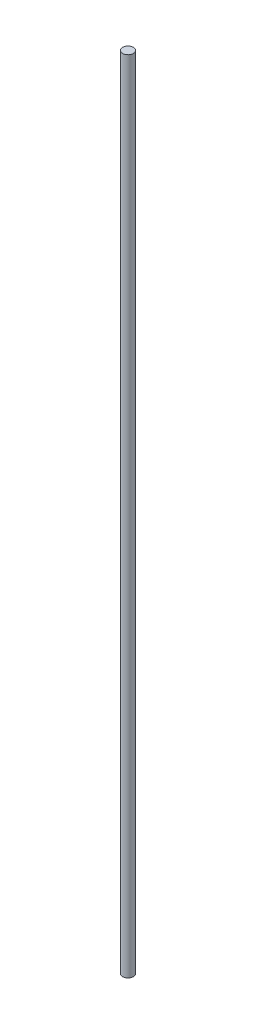
from build123d import *

# Parameters (mm, degrees)
SKETCH1_R           = 1.61925
BOSS_EXTRUDE1_DEPTH = 241.3


with BuildPart() as part:
    # Sketch1 → Boss-Extrude1 (new body)
    with BuildSketch(Plane(origin=(0, 0, 0), x_dir=(1, 0, 0), z_dir=(0, 1, 0))):
        Circle(SKETCH1_R)
    extrude(amount=BOSS_EXTRUDE1_DEPTH)


solid = part.part
